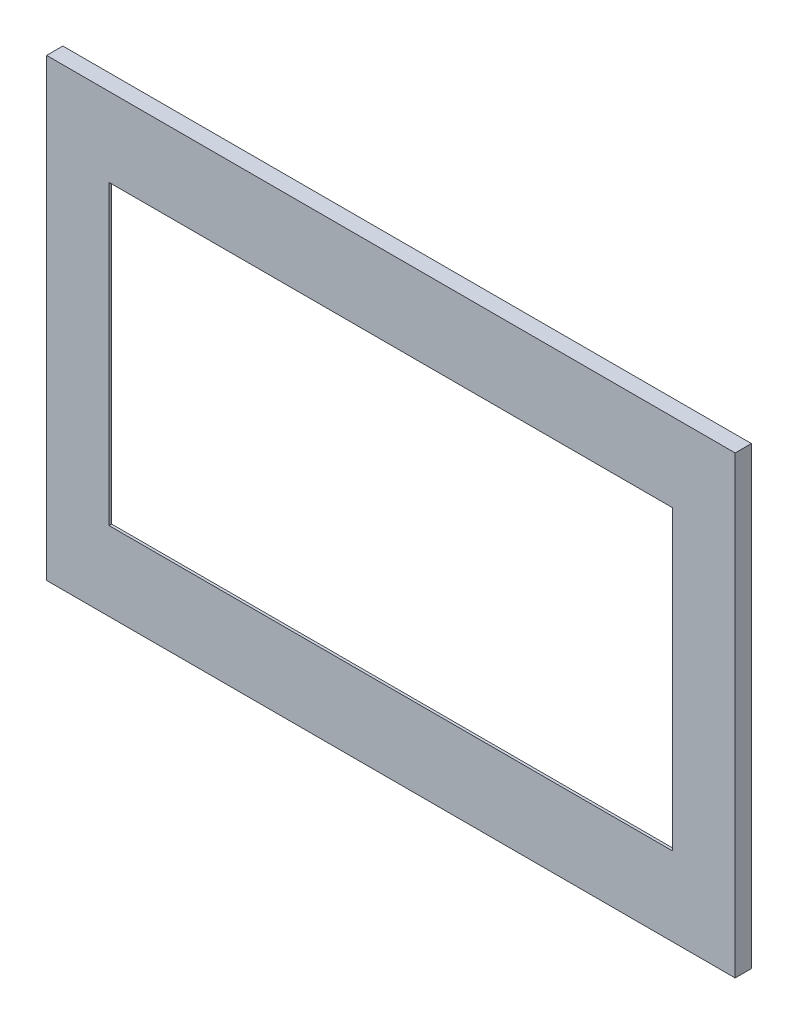
from build123d import *

# Parameters (mm, degrees)
SKETCH1_W               = 673.1
SKETCH1_H               = 444.5
BOSS_EXTRUDE1_DEPTH     = 7.9375
CUT_EXTRUDE1_DEPTH      = 404.624801796
CUT_EXTRUDE1_DEPTH_BACK = 404.624801796
SKETCH2_W               = 601.6625
SKETCH2_H               = 341.3125
SKETCH8_W               = 601.6625
SKETCH8_H               = 341.3125
SKETCH8_W_2             = 550.8625
SKETCH8_H_2             = 290.5125
BOSS_EXTRUDE3_DEPTH     = 2.54


with BuildPart() as part:
    # Sketch1 → Boss-Extrude1 (new, symmetric)
    with BuildSketch(Plane.XY):
        Rectangle(SKETCH1_W, SKETCH1_H)
    extrude(amount=BOSS_EXTRUDE1_DEPTH, both=True)

    # Sketch2 → Cut-Extrude1 (cut, two sides: drawn at the far end of the back side and taken through both)
    with BuildSketch(Plane.XY.offset(7.9375).offset(-CUT_EXTRUDE1_DEPTH_BACK)):
        Rectangle(SKETCH2_W, SKETCH2_H)
    extrude(amount=CUT_EXTRUDE1_DEPTH + CUT_EXTRUDE1_DEPTH_BACK, mode=Mode.SUBTRACT)

    # Sketch8 → Boss-Extrude3 (add)
    with BuildSketch(Plane.XY.offset(7.9375)):
        Rectangle(SKETCH8_W, SKETCH8_H)
        Rectangle(SKETCH8_W_2, SKETCH8_H_2, mode=Mode.SUBTRACT)
    extrude(amount=-BOSS_EXTRUDE3_DEPTH)


solid = part.part
